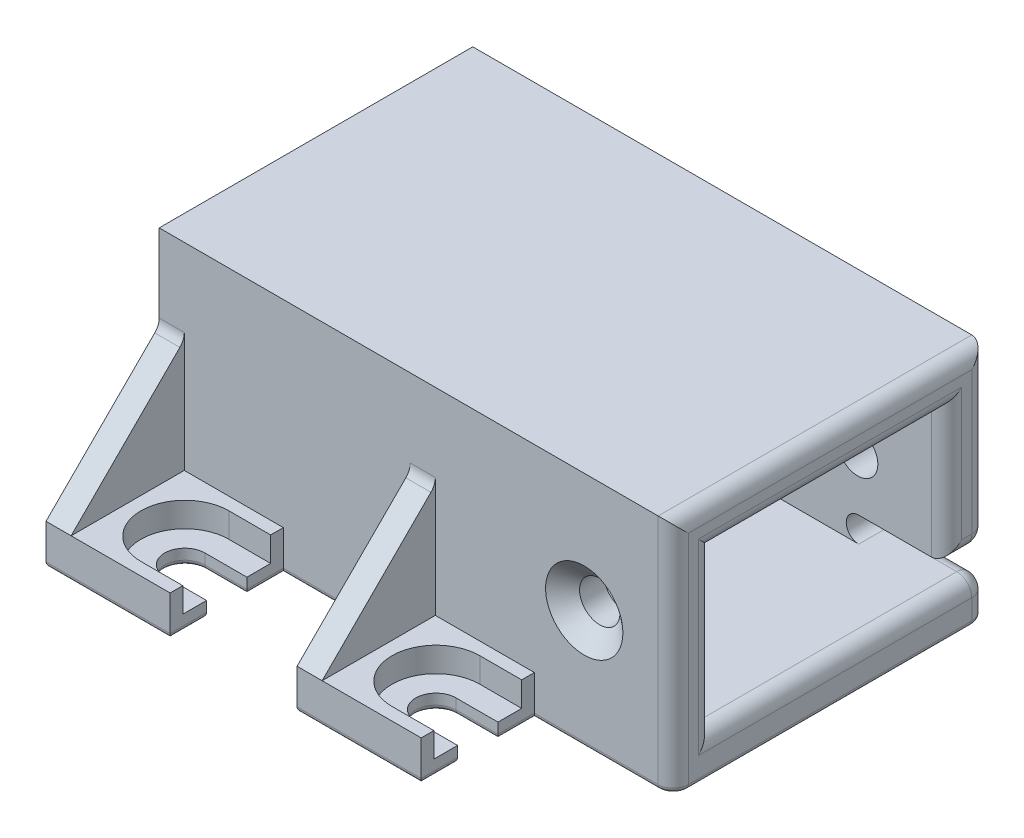
from build123d import *

# Parameters (mm, degrees)
SKETCH1_W                                          = 65.010000028
SKETCH1_H                                          = 39.660000182
SKETCH1_W_2                                        = 54.850000028
SKETCH1_H_2                                        = 29.500000182
BOSS_EXTRUDE1_DEPTH                                = 5.08
SKETCH1_3_W                                        = 65.010000028
SKETCH1_3_H                                        = 39.660000182
SKETCH1_3_W_2                                      = 54.850000028
SKETCH1_3_H_2                                      = 29.500000182
BOSS_EXTRUDE2_DEPTH                                = 19.900000078
BOSS_EXTRUDE3_START                                = 19.9
SKETCH1_4_W                                        = 65.010000028
SKETCH1_4_H                                        = 39.660000182
SKETCH1_4_W_2                                      = 54.850000028
SKETCH1_4_H_2                                      = 29.500000182
BOSS_EXTRUDE3_DEPTH                                = 5.08
SKETCH2_W                                          = 29.500000182
SKETCH2_H                                          = 19.900000078
CUT_EXTRUDE1_DEPTH                                 = 68.88839523
CSK_FOR_10_FLAT_HEAD_MACHINE_SCREW_100_D           = 5.1054
CSK_FOR_10_FLAT_HEAD_MACHINE_SCREW_100_CSINK_D     = 9.779
CSK_FOR_10_FLAT_HEAD_MACHINE_SCREW_100_CSINK_ANGLE = 100
F_10_0_1935_DIAMETER_HOLE1_D                       = 4.9149
SKETCH7_W                                          = 12.7
SKETCH7_H                                          = 3.175
CUT_EXTRUDE2_DEPTH                                 = 54.631630951
SKETCH8_W                                          = 15.700000096
SKETCH8_H                                          = 14.314999818
BOSS_EXTRUDE4_DEPTH                                = 5.08
CBORE_START                                        = -3.1242
CBORE_SLOT_FOR_10_BINDING_HEAD_MACHINE_DEPTH       = 3.1242
CBORE_START_2                                      = -5.08
CBORE_SLOT_FOR_10_BINDING_HEAD_MACH_3_DEPTH        = 1.9558
RIB1_REACH                                         = 79.564
SKETCH11_WALL_W                                    = 177.372562634
SKETCH11_WALL_H                                    = 3.175
RIB2_REACH                                         = 55.816
SKETCH12_WALL_W                                    = 129.875485106
SKETCH12_WALL_H                                    = 3.175
FILLET1_R                                          = 1.5875
FILLET2_R                                          = 0.635
FILLET3_R                                          = 1.905


# Read off the part's stored shape, not the designer's step: CBORE SLOT for #10 Binding Head Machine Screw1
# Some blends are built 0.0001 mm under size
with BuildPart() as part:
    # Sketch1 → Boss-Extrude1 (new body)
    # profile 1 of 2: a face of its own
    with BuildSketch(Plane(origin=(0, 0, 0), x_dir=(1, 0, 0), z_dir=(0, 1, 0))):
        Rectangle(SKETCH1_W, SKETCH1_H)
        Rectangle(SKETCH1_W_2, SKETCH1_H_2, mode=Mode.SUBTRACT)
    # profile 2 of 2: a face of its own
    with BuildSketch(Plane(origin=(0, 0, 0), x_dir=(1, 0, 0), z_dir=(0, 1, 0))):
        Rectangle(SKETCH1_W_2, SKETCH1_H_2)
    extrude(amount=-BOSS_EXTRUDE1_DEPTH)

    # Sketch1<3> → Boss-Extrude2 (add)
    with BuildSketch(Plane(origin=(0, 0, 0), x_dir=(1, 0, 0), z_dir=(0, 1, 0))):
        Rectangle(SKETCH1_3_W, SKETCH1_3_H)
        Rectangle(SKETCH1_3_W_2, SKETCH1_3_H_2, mode=Mode.SUBTRACT)
    extrude(amount=BOSS_EXTRUDE2_DEPTH)

    # Sketch1<4> → Boss-Extrude3 (add)
    # profile 1 of 2: a face of its own
    with BuildSketch(Plane(origin=(0, 0, 0), x_dir=(1, 0, 0), z_dir=(0, 1, 0)).offset(BOSS_EXTRUDE3_START)):
        Rectangle(SKETCH1_4_W, SKETCH1_4_H)
        Rectangle(SKETCH1_4_W_2, SKETCH1_4_H_2, mode=Mode.SUBTRACT)
    # profile 2 of 2: a face of its own
    with BuildSketch(Plane(origin=(0, 0, 0), x_dir=(1, 0, 0), z_dir=(0, 1, 0)).offset(BOSS_EXTRUDE3_START)):
        Rectangle(SKETCH1_4_W_2, SKETCH1_4_H_2)
    extrude(amount=BOSS_EXTRUDE3_DEPTH)

    # Sketch2 → Cut-Extrude1 (cut, through all)
    with BuildSketch(Plane(origin=(-27.425000014, 0, 0), x_dir=(0, 0, -1), z_dir=(1, 0, 0))):
        with Locations((0, 9.950000039)):
            Rectangle(SKETCH2_W, SKETCH2_H)
    extrude(amount=CUT_EXTRUDE1_DEPTH, mode=Mode.SUBTRACT)

    # CSK for #10 Flat Head Machine Screw (100)1 (through all)
    with Locations(Plane.XY.offset(19.830000091)):
        with Locations((21.249999918, 9.950000039)):
            CounterSinkHole(CSK_FOR_10_FLAT_HEAD_MACHINE_SCREW_100_D / 2, CSK_FOR_10_FLAT_HEAD_MACHINE_SCREW_100_CSINK_D / 2, counter_sink_angle=CSK_FOR_10_FLAT_HEAD_MACHINE_SCREW_100_CSINK_ANGLE)

    # #10 (0.1935) Diameter Hole1 (through all)
    with Locations(Plane(origin=(-27.425000014, 0, 0), x_dir=(0, 0, -1), z_dir=(1, 0, 0))):
        with Locations((0, 9.950000039)):
            Hole(F_10_0_1935_DIAMETER_HOLE1_D / 2)

    # Sketch7 → Cut-Extrude2 (cut, through all)
    with BuildSketch(Plane.XY.offset(-14.750000091)):
        with Locations((26.155000014, 1.5875)):
            Rectangle(SKETCH7_W, SKETCH7_H)
    extrude(amount=-CUT_EXTRUDE2_DEPTH, mode=Mode.SUBTRACT)

    # Sketch8 → Boss-Extrude4 (add)
    with BuildSketch(Plane(origin=(0, 0, 0), x_dir=(1, 0, 0), z_dir=(0, 1, 0))):
        with Locations((-24.654999966, 26.9875)):
            Rectangle(SKETCH8_W, SKETCH8_H)
        with Locations((7.095000034, -26.9875)):
            Rectangle(SKETCH8_W, SKETCH8_H)
        with Locations((-24.654999966, -26.9875)):
            Rectangle(SKETCH8_W, SKETCH8_H)
        with Locations((7.095000034, 26.9875)):
            Rectangle(SKETCH8_W, SKETCH8_H)
    extrude(amount=-BOSS_EXTRUDE4_DEPTH)

    # CBORE SLOT for _10 Binding Head Mach 2 → CBORE SLOT for #10 Binding Head Machine Screw1 (cut)
    with BuildSketch(Plane(origin=(0, 0, 0), x_dir=(1, 0, 0), z_dir=(0, 1, 0)).offset(CBORE_START)):
        with BuildLine():
            Line((-16.804999918, 32.54375), (-22.102299966, 32.54375))
            ThreePointArc((-22.102299966, 32.54375), (-27.658549966, 26.9875), (-22.102299966, 21.43125))
            Line((-22.102299966, 21.43125), (-16.804999918, 21.43125))
            Line((-16.804999918, 21.43125), (-16.804999918, 32.54375))
        make_face()
        with BuildLine():
            Line((14.945000082, 32.54375), (9.647700034, 32.54375))
            ThreePointArc((9.647700034, 32.54375), (4.091450034, 26.9875), (9.647700034, 21.43125))
            Line((9.647700034, 21.43125), (14.945000082, 21.43125))
            Line((14.945000082, 21.43125), (14.945000082, 32.54375))
        make_face()
        with BuildLine():
            Line((-16.804999918, -21.43125), (-22.102299966, -21.43125))
            ThreePointArc((-22.102299966, -21.43125), (-27.658549966, -26.9875), (-22.102299966, -32.54375))
            Line((-22.102299966, -32.54375), (-16.804999918, -32.54375))
            Line((-16.804999918, -32.54375), (-16.804999918, -21.43125))
        make_face()
        with BuildLine():
            Line((14.945000082, -21.43125), (9.647700034, -21.43125))
            ThreePointArc((9.647700034, -21.43125), (4.091450034, -26.9875), (9.647700034, -32.54375))
            Line((9.647700034, -32.54375), (14.945000082, -32.54375))
            Line((14.945000082, -32.54375), (14.945000082, -21.43125))
        make_face()
    extrude(amount=CBORE_SLOT_FOR_10_BINDING_HEAD_MACHINE_DEPTH, mode=Mode.SUBTRACT)

    # CBORE SLOT for _10 Binding Head Mach 3 o → CBORE SLOT for _10 Binding Head Mach 3 (cut)
    with BuildSketch(Plane(origin=(0, 0, 0), x_dir=(1, 0, 0), z_dir=(0, 1, 0)).offset(CBORE_START_2)):
        with BuildLine():
            Line((-16.804999918, 29.5402), (-22.102299966, 29.5402))
            ThreePointArc((-22.102299966, 29.5402), (-24.654999966, 26.9875), (-22.102299966, 24.4348))
            Line((-22.102299966, 24.4348), (-16.804999918, 24.4348))
            Line((-16.804999918, 24.4348), (-16.804999918, 29.5402))
        make_face()
        with BuildLine():
            Line((14.945000082, 24.4348), (14.945000082, 29.5402))
            Line((14.945000082, 29.5402), (9.647700034, 29.5402))
            ThreePointArc((9.647700034, 29.5402), (7.095000034, 26.9875), (9.647700034, 24.4348))
            Line((9.647700034, 24.4348), (14.945000082, 24.4348))
        make_face()
        with BuildLine():
            Line((-16.804999918, -24.4348), (-22.102299966, -24.4348))
            ThreePointArc((-22.102299966, -24.4348), (-24.654999966, -26.9875), (-22.102299966, -29.5402))
            Line((-22.102299966, -29.5402), (-16.804999918, -29.5402))
            Line((-16.804999918, -29.5402), (-16.804999918, -24.4348))
        make_face()
        with BuildLine():
            Line((14.945000082, -29.5402), (14.945000082, -24.4348))
            Line((14.945000082, -24.4348), (9.647700034, -24.4348))
            ThreePointArc((9.647700034, -24.4348), (7.095000034, -26.9875), (9.647700034, -29.5402))
            Line((9.647700034, -29.5402), (14.945000082, -29.5402))
        make_face()
    extrude(amount=CBORE_SLOT_FOR_10_BINDING_HEAD_MACH_3_DEPTH, mode=Mode.SUBTRACT)

    # Sketch11 wall → Rib1 (add, up to next)
    with BuildSketch(Plane(origin=(-32.505000014, 7.157499909, -26.9875), x_dir=(0, 0.707106781187, 0.707106781187), z_dir=(0, 0.707106781187, -0.707106781187)), mode=Mode.PRIVATE) as rib1_sk1:
        with Locations((0, 1.5875)):
            Rectangle(SKETCH11_WALL_W, SKETCH11_WALL_H)
    rib1_tool1 = extrude(rib1_sk1.sketch, amount=-RIB1_REACH, mode=Mode.PRIVATE) - part.part
    rib1 = rib1_tool1.solids().sort_by_distance((-32.505000014, 7.157499909, -26.9875))[0]
    add(rib1)

    # Mirror1: Rib1 across plane
    add(rib1.mirror(Plane.XY))

    # Sketch12 wall → Rib2 (add, up to next)
    with BuildSketch(Plane(origin=(-0.755000014, 7.157499909, -26.9875), x_dir=(0, 0.707106781187, 0.707106781187), z_dir=(0, 0.707106781187, -0.707106781187)), mode=Mode.PRIVATE) as rib2_sk1:
        with Locations((0, 1.5875)):
            Rectangle(SKETCH12_WALL_W, SKETCH12_WALL_H)
    rib2_tool1 = extrude(rib2_sk1.sketch, amount=-RIB2_REACH, mode=Mode.PRIVATE) - part.part
    rib2 = rib2_tool1.solids().sort_by_distance((-0.755000014, 7.157499909, -26.9875))[0]
    add(rib2)

    # Mirror2: Rib2 across plane
    add(rib2.mirror(Plane.XY))

    # Fillet1
    fillet1_edges = [part.edges().sort_by_distance(p)[0] for p in [
        (19.805000014, 0, -17.290000091),
        (19.805000014, 3.175, -17.290000091),
    ]]
    fillet(fillet1_edges, radius=FILLET1_R - 0.0001)  # a hair under: the kernel refuses the full size

    # Fillet2
    fillet2_edges = [part.edges().sort_by_distance(p)[0] for p in [
        (-8.779999966, -5.08, -19.830000091),
        (-24.654999966, -5.08, -34.144999909),
        (-16.804999918, -5.08, -31.842599954),
        (23.725000048, -5.08, -19.830000091),
        (14.945000082, -5.08, -31.842599954),
        (-0.755000014, -5.08, -26.9875),
        (7.095000034, -5.08, -34.144999909),
        (23.725000048, -5.08, 19.830000091),
        (14.945000082, -5.08, 22.132400045),
        (7.095000034, -5.08, 34.144999909),
        (-0.755000014, -5.08, 26.9875),
        (-8.779999966, -5.08, 19.830000091),
        (-16.804999918, -5.08, 22.132400045),
        (-24.654999966, -5.08, 34.144999909),
        (32.505000014, -5.08, 0),
        (-16.804999918, -5.08, -22.132400045),
        (-19.453649942, -5.08, -29.5402),
        (-24.654999966, -5.08, -26.9875),
        (-19.453649942, -5.08, -24.4348),
        (-16.804999918, -5.08, 31.842599954),
        (-19.453649942, -5.08, 24.4348),
        (-24.654999966, -5.08, 26.9875),
        (-19.453649942, -5.08, 29.5402),
        (14.945000082, -5.08, 31.842599954),
        (12.296350058, -5.08, 24.4348),
        (7.095000034, -5.08, 26.9875),
        (12.296350058, -5.08, 29.5402),
        (14.945000082, -5.08, -22.132400046),
        (12.296350058, -5.08, -29.5402),
        (7.095000034, -5.08, -26.9875),
        (12.296350058, -5.08, -24.4348),
        (-32.505000014, -5.08, 0),
    ]]
    fillet(fillet2_edges, radius=FILLET2_R)

    # Fillet3
    # the kernel refuses this fillet: 1.905 mm, written as the material it adds along each edge
    with BuildSketch(Plane(origin=(-32.505000014, 14.314999818, -19.830000091), x_dir=(0, 1, 0), z_dir=(1, 0, 0)), Plane(origin=(-0.755000014, 14.314999818, -19.830000091), x_dir=(0, 1, 0), z_dir=(1, 0, 0))) as fillet3_piece_1:
        with BuildLine():
            CenterArc((FILLET3_R * 0.414213562373, -FILLET3_R), FILLET3_R, 90, 45)
            Line((-FILLET3_R * 0.292893218813, -FILLET3_R * 0.292893218813), (-FILLET3_R * 0.307035354437, -FILLET3_R * 0.27875108319))
            Line((-FILLET3_R * 0.307035354437, -FILLET3_R * 0.27875108319), (-FILLET3_R * 0.00828427124746, FILLET3_R * 0.02))
            Line((-FILLET3_R * 0.00828427124746, FILLET3_R * 0.02), (FILLET3_R * 0.414213562373, FILLET3_R * 0.02))
            Line((FILLET3_R * 0.414213562373, FILLET3_R * 0.02), (FILLET3_R * 0.414213562373, 0))
        make_face()
    extrude(amount=3.175)
    with BuildSketch(Plane(origin=(-32.505000014, 14.314999818, 19.830000091), x_dir=(0, 1, 0), z_dir=(1, 0, 0)), Plane(origin=(-0.755000014, 14.314999818, 19.830000091), x_dir=(0, 1, 0), z_dir=(1, 0, 0))) as fillet3_piece_2:
        with BuildLine():
            CenterArc((FILLET3_R * 0.414213562373, FILLET3_R), FILLET3_R, 225, 45)
            Line((-FILLET3_R * 0.292893218813, FILLET3_R * 0.292893218813), (-FILLET3_R * 0.307035354437, FILLET3_R * 0.27875108319))
            Line((-FILLET3_R * 0.307035354437, FILLET3_R * 0.27875108319), (-FILLET3_R * 0.00828427124746, -FILLET3_R * 0.02))
            Line((-FILLET3_R * 0.00828427124746, -FILLET3_R * 0.02), (FILLET3_R * 0.414213562373, -FILLET3_R * 0.02))
            Line((FILLET3_R * 0.414213562373, -FILLET3_R * 0.02), (FILLET3_R * 0.414213562373, 0))
        make_face()
    extrude(amount=3.175)
    # the kernel refuses this fillet: 1.905 mm, written as the material it takes off along each edge
    with BuildSketch(Plane(origin=(30.600000014, -5.08, 17.925000091), x_dir=(1, 0, 0), z_dir=(0, 0, -1))) as fillet3_2_piece_1:
        with BuildLine():
            CenterArc((1.27, -0.635), 0.635, 0, 90)
            Line((1.905, -0.635), (1.905, 0))
            Line((1.905, 0), (1.27, 0))
        make_face()
    revolve(axis=Axis((30.600000014, -5.08, 17.925000091), (0, -1, 0)), revolution_arc=90, mode=Mode.SUBTRACT)
    with BuildSketch(Plane(origin=(30.600000014, -5.08, -17.925000091), x_dir=(0, 0, -1), z_dir=(-1, 0, 0))) as fillet3_2_piece_2:
        with BuildLine():
            CenterArc((1.27, -0.635), 0.635, 0, 90)
            Line((1.905, -0.635), (1.905, 0))
            Line((1.905, 0), (1.27, 0))
        make_face()
    revolve(axis=Axis((30.600000014, -5.08, -17.925000091), (0, -1, 0)), revolution_arc=90, mode=Mode.SUBTRACT)
    with BuildSketch(Plane(origin=(30.600000014, -1.905, -17.925000091), x_dir=(0, 1, 0), z_dir=(0, 0, -1))) as fillet3_2_piece_3_section:
        Polygon((0, 0), (FILLET3_R * 1.02, 0), (FILLET3_R * 1.02, FILLET3_R * 1.02), (0, FILLET3_R * 1.02), align=None)
    fillet3_2_piece_3 = extrude(amount=FILLET3_R * 1.02, mode=Mode.PRIVATE)
    fillet3_2_piece_3 = fillet3_2_piece_3 - Plane(origin=(30.600000014, -1.905, -17.925000091), x_dir=(-0.7071067811865475, -0.7071067811865476, 0), z_dir=(0, 0, -1)) * Sphere(FILLET3_R, mode=Mode.PRIVATE)
    add(fillet3_2_piece_3, mode=Mode.SUBTRACT)
    with BuildSketch(Plane(origin=(30.600000014, 5.08, -17.925000091), x_dir=(1, 0, 0), z_dir=(0, 0, -1))) as fillet3_2_piece_4_section:
        Polygon((0, 0), (FILLET3_R * 1.02, 0), (FILLET3_R * 1.02, FILLET3_R * 1.02), (0, FILLET3_R * 1.02), align=None)
    fillet3_2_piece_4 = extrude(amount=FILLET3_R * 1.02, mode=Mode.PRIVATE)
    fillet3_2_piece_4 = fillet3_2_piece_4 - Plane(origin=(30.600000014, 5.08, -17.925000091), x_dir=(-0.7071067811865477, 0.7071067811865475, 0), z_dir=(0, 0, -1)) * Sphere(FILLET3_R, mode=Mode.PRIVATE)
    add(fillet3_2_piece_4, mode=Mode.SUBTRACT)
    with BuildSketch(Plane(origin=(32.505000014, 24.98, -19.830000091), x_dir=(-1, 0, 0), z_dir=(0, 0, 1))) as fillet3_2_piece_5:
        with BuildLine():
            CenterArc((FILLET3_R, FILLET3_R), FILLET3_R, 180, 90)
            Line((0, FILLET3_R), (-FILLET3_R * 0.02, FILLET3_R))
            Line((-FILLET3_R * 0.02, FILLET3_R), (-FILLET3_R * 0.02, -FILLET3_R * 0.02))
            Line((-FILLET3_R * 0.02, -FILLET3_R * 0.02), (FILLET3_R, -FILLET3_R * 0.02))
            Line((FILLET3_R, -FILLET3_R * 0.02), (FILLET3_R, 0))
        make_face()
    extrude(amount=39.660000182, mode=Mode.SUBTRACT)
    with BuildSketch(Plane(origin=(30.600000014, 0, -19.830000091), x_dir=(0, -1, 0), z_dir=(-1, 0, 0)), Plane(origin=(21.392400014, 3.175, -19.830000091), x_dir=(0, 1, 0), z_dir=(1, 0, 0))) as fillet3_2_piece_6:
        with BuildLine():
            CenterArc((FILLET3_R, FILLET3_R), FILLET3_R, 180, 90)
            Line((0, FILLET3_R), (-FILLET3_R * 0.02, FILLET3_R))
            Line((-FILLET3_R * 0.02, FILLET3_R), (-FILLET3_R * 0.02, -FILLET3_R * 0.02))
            Line((-FILLET3_R * 0.02, -FILLET3_R * 0.02), (FILLET3_R, -FILLET3_R * 0.02))
            Line((FILLET3_R, -FILLET3_R * 0.02), (FILLET3_R, 0))
        make_face()
    extrude(amount=9.2076, mode=Mode.SUBTRACT)
    with BuildSketch(Plane(origin=(19.805000014, 1.5874, -19.830000091), x_dir=(-1, 0, 0), z_dir=(0, 1, 0))) as fillet3_2_piece_7:
        with BuildLine():
            CenterArc((FILLET3_R, FILLET3_R), FILLET3_R, 180, 90)
            Line((0, FILLET3_R), (-FILLET3_R * 0.02, FILLET3_R))
            Line((-FILLET3_R * 0.02, FILLET3_R), (-FILLET3_R * 0.02, -FILLET3_R * 0.02))
            Line((-FILLET3_R * 0.02, -FILLET3_R * 0.02), (FILLET3_R, -FILLET3_R * 0.02))
            Line((FILLET3_R, -FILLET3_R * 0.02), (FILLET3_R, 0))
        make_face()
    extrude(amount=0.0002, mode=Mode.SUBTRACT)
    with BuildSketch(Plane(origin=(32.505000014, -5.08, 19.830000091), x_dir=(-1, 0, 0), z_dir=(0, 1, 0))) as fillet3_2_piece_8:
        with BuildLine():
            CenterArc((FILLET3_R, -FILLET3_R), FILLET3_R, 90, 90)
            Line((0, -FILLET3_R), (-FILLET3_R * 0.02, -FILLET3_R))
            Line((-FILLET3_R * 0.02, -FILLET3_R), (-FILLET3_R * 0.02, FILLET3_R * 0.02))
            Line((-FILLET3_R * 0.02, FILLET3_R * 0.02), (FILLET3_R, FILLET3_R * 0.02))
            Line((FILLET3_R, FILLET3_R * 0.02), (FILLET3_R, 0))
        make_face()
    extrude(amount=30.06, mode=Mode.SUBTRACT)
    with BuildSketch(Plane(origin=(32.505000014, -1.905, -19.830000091), x_dir=(-1, 0, 0), z_dir=(0, -1, 0))) as fillet3_2_piece_9:
        with BuildLine():
            CenterArc((FILLET3_R, -FILLET3_R), FILLET3_R, 90, 90)
            Line((0, -FILLET3_R), (-FILLET3_R * 0.02, -FILLET3_R))
            Line((-FILLET3_R * 0.02, -FILLET3_R), (-FILLET3_R * 0.02, FILLET3_R * 0.02))
            Line((-FILLET3_R * 0.02, FILLET3_R * 0.02), (FILLET3_R, FILLET3_R * 0.02))
            Line((FILLET3_R, FILLET3_R * 0.02), (FILLET3_R, 0))
        make_face()
    extrude(amount=3.175, mode=Mode.SUBTRACT)
    with BuildSketch(Plane(origin=(32.505000014, 0, 14.750000091), x_dir=(-1, 0, 0), z_dir=(0, 1, 0))) as fillet3_2_piece_10:
        with BuildLine():
            CenterArc((FILLET3_R, FILLET3_R), FILLET3_R, 180, 90)
            Line((0, FILLET3_R), (-FILLET3_R * 0.02, FILLET3_R))
            Line((-FILLET3_R * 0.02, FILLET3_R), (-FILLET3_R * 0.02, -FILLET3_R * 0.02))
            Line((-FILLET3_R * 0.02, -FILLET3_R * 0.02), (FILLET3_R, -FILLET3_R * 0.02))
            Line((FILLET3_R, -FILLET3_R * 0.02), (FILLET3_R, 0))
        make_face()
    extrude(amount=19.900000078, mode=Mode.SUBTRACT)
    with BuildSketch(Plane(origin=(32.505000014, 0, -17.925000091), x_dir=(-1, 0, 0), z_dir=(0, 0, 1))) as fillet3_2_piece_11:
        with BuildLine():
            CenterArc((FILLET3_R, FILLET3_R), FILLET3_R, 180, 90)
            Line((0, FILLET3_R), (-FILLET3_R * 0.02, FILLET3_R))
            Line((-FILLET3_R * 0.02, FILLET3_R), (-FILLET3_R * 0.02, -FILLET3_R * 0.02))
            Line((-FILLET3_R * 0.02, -FILLET3_R * 0.02), (FILLET3_R, -FILLET3_R * 0.02))
            Line((FILLET3_R, -FILLET3_R * 0.02), (FILLET3_R, 0))
        make_face()
    extrude(amount=32.675000182, mode=Mode.SUBTRACT)
    with BuildSketch(Plane(origin=(32.505000014, 19.900000078, 14.750000091), x_dir=(-1, 0, 0), z_dir=(0, 0, -1))) as fillet3_2_piece_12:
        with BuildLine():
            CenterArc((FILLET3_R, FILLET3_R), FILLET3_R, 180, 90)
            Line((0, FILLET3_R), (-FILLET3_R * 0.02, FILLET3_R))
            Line((-FILLET3_R * 0.02, FILLET3_R), (-FILLET3_R * 0.02, -FILLET3_R * 0.02))
            Line((-FILLET3_R * 0.02, -FILLET3_R * 0.02), (FILLET3_R, -FILLET3_R * 0.02))
            Line((FILLET3_R, -FILLET3_R * 0.02), (FILLET3_R, 0))
        make_face()
    extrude(amount=29.500000182, mode=Mode.SUBTRACT)
    with BuildSketch(Plane(origin=(-32.505000014, 9.950000039, 0), x_dir=(0, 0, 1), z_dir=(0, -1, 0))) as fillet3_2_piece_13:
        with BuildLine():
            CenterArc((2.45745 + FILLET3_R, -FILLET3_R), FILLET3_R, 90, 90)
            Line((2.45745 + FILLET3_R, 0), (2.45745 + FILLET3_R, FILLET3_R * 0.02))
            Line((2.45745 + FILLET3_R, FILLET3_R * 0.02), (2.45745 - FILLET3_R * 0.02, FILLET3_R * 0.02))
            Line((2.45745 - FILLET3_R * 0.02, FILLET3_R * 0.02), (2.45745 - FILLET3_R * 0.02, -FILLET3_R))
            Line((2.45745 - FILLET3_R * 0.02, -FILLET3_R), (2.45745, -FILLET3_R))
        make_face()
    revolve(axis=Axis((-32.505000014, 9.950000039, 0), (-1, 0, 0)), mode=Mode.SUBTRACT)
    with BuildSketch(Plane(origin=(32.505000014, 24.98, -19.830000091), x_dir=(-1, 0, 0), z_dir=(0, -1, 0))) as fillet3_2_piece_14:
        with BuildLine():
            CenterArc((FILLET3_R, -FILLET3_R), FILLET3_R, 90, 90)
            Line((0, -FILLET3_R), (-FILLET3_R * 0.02, -FILLET3_R))
            Line((-FILLET3_R * 0.02, -FILLET3_R), (-FILLET3_R * 0.02, FILLET3_R * 0.02))
            Line((-FILLET3_R * 0.02, FILLET3_R * 0.02), (FILLET3_R, FILLET3_R * 0.02))
            Line((FILLET3_R, FILLET3_R * 0.02), (FILLET3_R, 0))
        make_face()
    extrude(amount=19.9, mode=Mode.SUBTRACT)
    with BuildSketch(Plane(origin=(32.505000014, 19.900000078, -14.750000091), x_dir=(-1, 0, 0), z_dir=(0, -1, 0))) as fillet3_2_piece_15:
        with BuildLine():
            CenterArc((FILLET3_R, FILLET3_R), FILLET3_R, 180, 90)
            Line((0, FILLET3_R), (-FILLET3_R * 0.02, FILLET3_R))
            Line((-FILLET3_R * 0.02, FILLET3_R), (-FILLET3_R * 0.02, -FILLET3_R * 0.02))
            Line((-FILLET3_R * 0.02, -FILLET3_R * 0.02), (FILLET3_R, -FILLET3_R * 0.02))
            Line((FILLET3_R, -FILLET3_R * 0.02), (FILLET3_R, 0))
        make_face()
    extrude(amount=16.725000078, mode=Mode.SUBTRACT)
    with BuildSketch(Plane(origin=(32.505000014, 3.175, -14.750000091), x_dir=(-1, 0, 0), z_dir=(0, 0, -1))) as fillet3_2_piece_16:
        with BuildLine():
            CenterArc((FILLET3_R, FILLET3_R), FILLET3_R, 180, 90)
            Line((0, FILLET3_R), (-FILLET3_R * 0.02, FILLET3_R))
            Line((-FILLET3_R * 0.02, FILLET3_R), (-FILLET3_R * 0.02, -FILLET3_R * 0.02))
            Line((-FILLET3_R * 0.02, -FILLET3_R * 0.02), (FILLET3_R, -FILLET3_R * 0.02))
            Line((FILLET3_R, -FILLET3_R * 0.02), (FILLET3_R, 0))
        make_face()
    extrude(amount=3.175, mode=Mode.SUBTRACT)
    with BuildSketch(Plane(origin=(21.392400014, 1.5876, -19.830000091), x_dir=(0, 1, 0), z_dir=(1, 0, 0))) as fillet3_2_piece_17:
        with BuildLine():
            CenterArc((1.5874 + FILLET3_R, FILLET3_R), FILLET3_R, 180, 90)
            Line((1.5874, FILLET3_R), (1.5874 - FILLET3_R * 0.02, FILLET3_R))
            Line((1.5874 - FILLET3_R * 0.02, FILLET3_R), (1.5874 - FILLET3_R * 0.02, -FILLET3_R * 0.02))
            Line((1.5874 - FILLET3_R * 0.02, -FILLET3_R * 0.02), (1.5874 + FILLET3_R, -FILLET3_R * 0.02))
            Line((1.5874 + FILLET3_R, -FILLET3_R * 0.02), (1.5874 + FILLET3_R, 0))
        make_face()
    revolve(axis=Axis((21.392400014, 1.5876, -19.830000091), (0, 0, 1)), revolution_arc=90, mode=Mode.SUBTRACT)
    with BuildSketch(Plane(origin=(21.392400014, 1.5874, -19.830000091), x_dir=(-1, 0, 0), z_dir=(0, 1, 0))) as fillet3_2_piece_18:
        with BuildLine():
            CenterArc((1.5874 + FILLET3_R, FILLET3_R), FILLET3_R, 180, 90)
            Line((1.5874, FILLET3_R), (1.5874 - FILLET3_R * 0.02, FILLET3_R))
            Line((1.5874 - FILLET3_R * 0.02, FILLET3_R), (1.5874 - FILLET3_R * 0.02, -FILLET3_R * 0.02))
            Line((1.5874 - FILLET3_R * 0.02, -FILLET3_R * 0.02), (1.5874 + FILLET3_R, -FILLET3_R * 0.02))
            Line((1.5874 + FILLET3_R, -FILLET3_R * 0.02), (1.5874 + FILLET3_R, 0))
        make_face()
    revolve(axis=Axis((21.392400014, 1.5874, -19.830000091), (0, 0, 1)), revolution_arc=90, mode=Mode.SUBTRACT)
    with BuildSketch(Plane(origin=(32.505000014, 29.7425, -19.830000091), x_dir=(-1, 0, 0), z_dir=(0, -1, 0))) as fillet3_2_piece_19a_section:
        with BuildLine():
            CenterArc((FILLET3_R, -FILLET3_R), FILLET3_R, 90, 90)
            Line((0, -FILLET3_R), (-FILLET3_R * 0.02, -FILLET3_R))
            Line((-FILLET3_R * 0.02, -FILLET3_R), (-FILLET3_R * 0.02, FILLET3_R * 0.02))
            Line((-FILLET3_R * 0.02, FILLET3_R * 0.02), (FILLET3_R, FILLET3_R * 0.02))
            Line((FILLET3_R, FILLET3_R * 0.02), (FILLET3_R, 0))
        make_face()
    fillet3_2_piece_19a = extrude(amount=24.6625, mode=Mode.PRIVATE)
    fillet3_2_piece_19a = split(fillet3_2_piece_19a, bisect_by=Plane(origin=(32.073717321, 24.98, -19.398717398), z_dir=(0, 1, 0)), keep=Keep.TOP, mode=Mode.PRIVATE)
    with BuildSketch(Plane(origin=(32.505000014, 24.98, -24.592500091), x_dir=(-1, 0, 0), z_dir=(0, 0, 1))) as fillet3_2_piece_19b_section:
        with BuildLine():
            CenterArc((FILLET3_R, FILLET3_R), FILLET3_R, 180, 90)
            Line((0, FILLET3_R), (-FILLET3_R * 0.02, FILLET3_R))
            Line((-FILLET3_R * 0.02, FILLET3_R), (-FILLET3_R * 0.02, -FILLET3_R * 0.02))
            Line((-FILLET3_R * 0.02, -FILLET3_R * 0.02), (FILLET3_R, -FILLET3_R * 0.02))
            Line((FILLET3_R, -FILLET3_R * 0.02), (FILLET3_R, 0))
        make_face()
    fillet3_2_piece_19b = extrude(amount=44.422500182, mode=Mode.PRIVATE)
    fillet3_2_piece_19b = split(fillet3_2_piece_19b, bisect_by=Plane(origin=(32.073717321, 24.548717307, -19.830000091), z_dir=(0, 0, -1)), keep=Keep.TOP, mode=Mode.PRIVATE)
    fillet3_2_piece_19 = fillet3_2_piece_19a & fillet3_2_piece_19b
    add(fillet3_2_piece_19, mode=Mode.SUBTRACT)
    with BuildSketch(Plane(origin=(32.505000014, -5.08, 19.830000091), x_dir=(-1, 0, 0), z_dir=(0, 1, 0))) as fillet3_2_piece_20a_section:
        with BuildLine():
            CenterArc((FILLET3_R, -FILLET3_R), FILLET3_R, 90, 90)
            Line((0, -FILLET3_R), (-FILLET3_R * 0.02, -FILLET3_R))
            Line((-FILLET3_R * 0.02, -FILLET3_R), (-FILLET3_R * 0.02, FILLET3_R * 0.02))
            Line((-FILLET3_R * 0.02, FILLET3_R * 0.02), (FILLET3_R, FILLET3_R * 0.02))
            Line((FILLET3_R, FILLET3_R * 0.02), (FILLET3_R, 0))
        make_face()
    fillet3_2_piece_20a = extrude(amount=34.8225, mode=Mode.PRIVATE)
    fillet3_2_piece_20a = split(fillet3_2_piece_20a, bisect_by=Plane(origin=(32.073717321, 24.98, 19.398717398), z_dir=(0, 1, 0)), keep=Keep.TOP, mode=Mode.PRIVATE)
    with BuildSketch(Plane(origin=(32.505000014, 24.98, -19.830000091), x_dir=(-1, 0, 0), z_dir=(0, 0, 1))) as fillet3_2_piece_20b_section:
        with BuildLine():
            CenterArc((FILLET3_R, FILLET3_R), FILLET3_R, 180, 90)
            Line((0, FILLET3_R), (-FILLET3_R * 0.02, FILLET3_R))
            Line((-FILLET3_R * 0.02, FILLET3_R), (-FILLET3_R * 0.02, -FILLET3_R * 0.02))
            Line((-FILLET3_R * 0.02, -FILLET3_R * 0.02), (FILLET3_R, -FILLET3_R * 0.02))
            Line((FILLET3_R, -FILLET3_R * 0.02), (FILLET3_R, 0))
        make_face()
    fillet3_2_piece_20b = extrude(amount=44.422500182, mode=Mode.PRIVATE)
    fillet3_2_piece_20b = split(fillet3_2_piece_20b, bisect_by=Plane(origin=(32.073717321, 24.548717307, 19.830000091), z_dir=(0, 0, 1)), keep=Keep.TOP, mode=Mode.PRIVATE)
    fillet3_2_piece_20 = fillet3_2_piece_20a & fillet3_2_piece_20b
    add(fillet3_2_piece_20, mode=Mode.SUBTRACT)
    with BuildSketch(Plane(origin=(32.505000014, -4.7625, 14.750000091), x_dir=(-1, 0, 0), z_dir=(0, 1, 0))) as fillet3_2_piece_21a_section:
        with BuildLine():
            CenterArc((FILLET3_R, FILLET3_R), FILLET3_R, 180, 90)
            Line((0, FILLET3_R), (-FILLET3_R * 0.02, FILLET3_R))
            Line((-FILLET3_R * 0.02, FILLET3_R), (-FILLET3_R * 0.02, -FILLET3_R * 0.02))
            Line((-FILLET3_R * 0.02, -FILLET3_R * 0.02), (FILLET3_R, -FILLET3_R * 0.02))
            Line((FILLET3_R, -FILLET3_R * 0.02), (FILLET3_R, 0))
        make_face()
    fillet3_2_piece_21a = extrude(amount=24.662500078, mode=Mode.PRIVATE)
    fillet3_2_piece_21a = split(fillet3_2_piece_21a, bisect_by=Plane(origin=(32.073717321, 0, 15.181282784), z_dir=(0, -1, 0)), keep=Keep.TOP, mode=Mode.PRIVATE)
    with BuildSketch(Plane(origin=(32.505000014, 0, -17.925000091), x_dir=(-1, 0, 0), z_dir=(0, 0, 1))) as fillet3_2_piece_21b_section:
        with BuildLine():
            CenterArc((FILLET3_R, FILLET3_R), FILLET3_R, 180, 90)
            Line((0, FILLET3_R), (-FILLET3_R * 0.02, FILLET3_R))
            Line((-FILLET3_R * 0.02, FILLET3_R), (-FILLET3_R * 0.02, -FILLET3_R * 0.02))
            Line((-FILLET3_R * 0.02, -FILLET3_R * 0.02), (FILLET3_R, -FILLET3_R * 0.02))
            Line((FILLET3_R, -FILLET3_R * 0.02), (FILLET3_R, 0))
        make_face()
    fillet3_2_piece_21b = extrude(amount=37.437500182, mode=Mode.PRIVATE)
    fillet3_2_piece_21b = split(fillet3_2_piece_21b, bisect_by=Plane(origin=(32.073717321, -0.431282693, 14.750000091), z_dir=(0, 0, 1)), keep=Keep.TOP, mode=Mode.PRIVATE)
    fillet3_2_piece_21 = fillet3_2_piece_21a & fillet3_2_piece_21b
    add(fillet3_2_piece_21, mode=Mode.SUBTRACT)
    with BuildSketch(Plane(origin=(32.505000014, 19.900000078, 19.512500091), x_dir=(-1, 0, 0), z_dir=(0, 0, -1))) as fillet3_2_piece_22a_section:
        with BuildLine():
            CenterArc((FILLET3_R, FILLET3_R), FILLET3_R, 180, 90)
            Line((0, FILLET3_R), (-FILLET3_R * 0.02, FILLET3_R))
            Line((-FILLET3_R * 0.02, FILLET3_R), (-FILLET3_R * 0.02, -FILLET3_R * 0.02))
            Line((-FILLET3_R * 0.02, -FILLET3_R * 0.02), (FILLET3_R, -FILLET3_R * 0.02))
            Line((FILLET3_R, -FILLET3_R * 0.02), (FILLET3_R, 0))
        make_face()
    fillet3_2_piece_22a = extrude(amount=34.262500182, mode=Mode.PRIVATE)
    fillet3_2_piece_22a = split(fillet3_2_piece_22a, bisect_by=Plane(origin=(32.073717321, 20.331282771, 14.750000091), z_dir=(0, 0, 1)), keep=Keep.TOP, mode=Mode.PRIVATE)
    with BuildSketch(Plane(origin=(32.505000014, 0, 14.750000091), x_dir=(-1, 0, 0), z_dir=(0, 1, 0))) as fillet3_2_piece_22b_section:
        with BuildLine():
            CenterArc((FILLET3_R, FILLET3_R), FILLET3_R, 180, 90)
            Line((0, FILLET3_R), (-FILLET3_R * 0.02, FILLET3_R))
            Line((-FILLET3_R * 0.02, FILLET3_R), (-FILLET3_R * 0.02, -FILLET3_R * 0.02))
            Line((-FILLET3_R * 0.02, -FILLET3_R * 0.02), (FILLET3_R, -FILLET3_R * 0.02))
            Line((FILLET3_R, -FILLET3_R * 0.02), (FILLET3_R, 0))
        make_face()
    fillet3_2_piece_22b = extrude(amount=24.662500078, mode=Mode.PRIVATE)
    fillet3_2_piece_22b = split(fillet3_2_piece_22b, bisect_by=Plane(origin=(32.073717321, 19.900000078, 15.181282784), z_dir=(0, 1, 0)), keep=Keep.TOP, mode=Mode.PRIVATE)
    fillet3_2_piece_22 = fillet3_2_piece_22a & fillet3_2_piece_22b
    add(fillet3_2_piece_22, mode=Mode.SUBTRACT)
    with BuildSketch(Plane(origin=(32.505000014, 24.662500078, -14.750000091), x_dir=(-1, 0, 0), z_dir=(0, -1, 0))) as fillet3_2_piece_23a_section:
        with BuildLine():
            CenterArc((FILLET3_R, FILLET3_R), FILLET3_R, 180, 90)
            Line((0, FILLET3_R), (-FILLET3_R * 0.02, FILLET3_R))
            Line((-FILLET3_R * 0.02, FILLET3_R), (-FILLET3_R * 0.02, -FILLET3_R * 0.02))
            Line((-FILLET3_R * 0.02, -FILLET3_R * 0.02), (FILLET3_R, -FILLET3_R * 0.02))
            Line((FILLET3_R, -FILLET3_R * 0.02), (FILLET3_R, 0))
        make_face()
    fillet3_2_piece_23a = extrude(amount=21.487500078, mode=Mode.PRIVATE)
    fillet3_2_piece_23a = split(fillet3_2_piece_23a, bisect_by=Plane(origin=(32.073717321, 19.900000078, -15.181282784), z_dir=(0, 1, 0)), keep=Keep.TOP, mode=Mode.PRIVATE)
    with BuildSketch(Plane(origin=(32.505000014, 19.900000078, 14.750000091), x_dir=(-1, 0, 0), z_dir=(0, 0, -1))) as fillet3_2_piece_23b_section:
        with BuildLine():
            CenterArc((FILLET3_R, FILLET3_R), FILLET3_R, 180, 90)
            Line((0, FILLET3_R), (-FILLET3_R * 0.02, FILLET3_R))
            Line((-FILLET3_R * 0.02, FILLET3_R), (-FILLET3_R * 0.02, -FILLET3_R * 0.02))
            Line((-FILLET3_R * 0.02, -FILLET3_R * 0.02), (FILLET3_R, -FILLET3_R * 0.02))
            Line((FILLET3_R, -FILLET3_R * 0.02), (FILLET3_R, 0))
        make_face()
    fillet3_2_piece_23b = extrude(amount=34.262500182, mode=Mode.PRIVATE)
    fillet3_2_piece_23b = split(fillet3_2_piece_23b, bisect_by=Plane(origin=(32.073717321, 20.331282771, -14.750000091), z_dir=(0, 0, -1)), keep=Keep.TOP, mode=Mode.PRIVATE)
    fillet3_2_piece_23 = fillet3_2_piece_23a & fillet3_2_piece_23b
    add(fillet3_2_piece_23, mode=Mode.SUBTRACT)
    with BuildSketch(Plane(origin=(32.505000014, 19.900000078, -14.750000091), x_dir=(-1, 0, 0), z_dir=(0, -1, 0))) as fillet3_2_piece_24a_section:
        with BuildLine():
            CenterArc((FILLET3_R, FILLET3_R), FILLET3_R, 180, 90)
            Line((0, FILLET3_R), (-FILLET3_R * 0.02, FILLET3_R))
            Line((-FILLET3_R * 0.02, FILLET3_R), (-FILLET3_R * 0.02, -FILLET3_R * 0.02))
            Line((-FILLET3_R * 0.02, -FILLET3_R * 0.02), (FILLET3_R, -FILLET3_R * 0.02))
            Line((FILLET3_R, -FILLET3_R * 0.02), (FILLET3_R, 0))
        make_face()
    fillet3_2_piece_24a = extrude(amount=21.487500078, mode=Mode.PRIVATE)
    fillet3_2_piece_24a = split(fillet3_2_piece_24a, bisect_by=Plane(origin=(32.073717321, 3.175, -15.181282784), z_dir=(0, -1, 0)), keep=Keep.TOP, mode=Mode.PRIVATE)
    with BuildSketch(Plane(origin=(32.505000014, 3.175, -9.987500091), x_dir=(-1, 0, 0), z_dir=(0, 0, -1))) as fillet3_2_piece_24b_section:
        with BuildLine():
            CenterArc((FILLET3_R, FILLET3_R), FILLET3_R, 180, 90)
            Line((0, FILLET3_R), (-FILLET3_R * 0.02, FILLET3_R))
            Line((-FILLET3_R * 0.02, FILLET3_R), (-FILLET3_R * 0.02, -FILLET3_R * 0.02))
            Line((-FILLET3_R * 0.02, -FILLET3_R * 0.02), (FILLET3_R, -FILLET3_R * 0.02))
            Line((FILLET3_R, -FILLET3_R * 0.02), (FILLET3_R, 0))
        make_face()
    fillet3_2_piece_24b = extrude(amount=7.9375, mode=Mode.PRIVATE)
    fillet3_2_piece_24b = split(fillet3_2_piece_24b, bisect_by=Plane(origin=(32.073717321, 3.606282693, -14.750000091), z_dir=(0, 0, 1)), keep=Keep.TOP, mode=Mode.PRIVATE)
    fillet3_2_piece_24 = fillet3_2_piece_24a & fillet3_2_piece_24b
    add(fillet3_2_piece_24, mode=Mode.SUBTRACT)


solid = part.part
